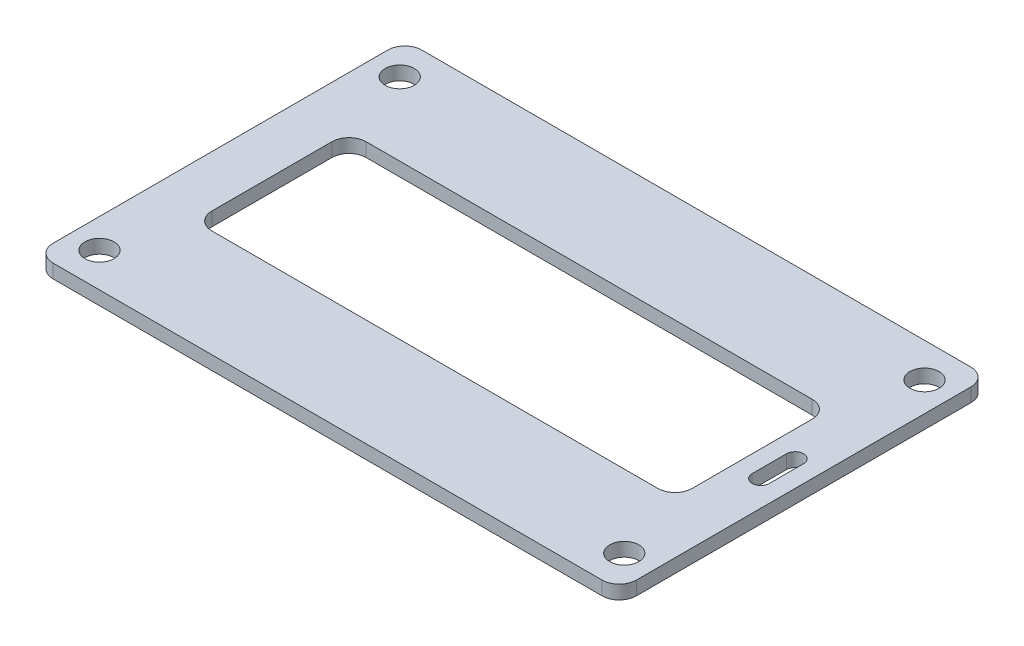
from build123d import *

# Parameters (mm, degrees)
SKETCH1_R           = 1.7
BOSS_EXTRUDE1_DEPTH = 1.6


with BuildPart() as part:
    # Sketch1 → Boss-Extrude1 (new body)
    with BuildSketch(Plane(origin=(0, 0, 0), x_dir=(1, 0, 0), z_dir=(0, 1, 0))):
        with BuildLine():
            Line((-32, -21.5), (32, -21.5))
            ThreePointArc((32, -21.5), (33.414213562, -20.914213562), (34, -19.5))
            Line((34, -19.5), (34, 19.5))
            ThreePointArc((34, 19.5), (33.414213562, 20.914213562), (32, 21.5))
            Line((32, 21.5), (-32, 21.5))
            ThreePointArc((-32, 21.5), (-33.414213562, 20.914213562), (-34, 19.5))
            Line((-34, 19.5), (-34, -19.5))
            ThreePointArc((-34, -19.5), (-33.414213562, -20.914213562), (-32, -21.5))
        make_face()
        with Locations((30.588511348, 17.5)):
            Circle(SKETCH1_R, mode=Mode.SUBTRACT)
        with Locations((-30.588511348, 17.5)):
            Circle(SKETCH1_R, mode=Mode.SUBTRACT)
        with Locations((-30.588511348, -17.5)):
            Circle(SKETCH1_R, mode=Mode.SUBTRACT)
        with Locations((30.588511348, -17.5)):
            Circle(SKETCH1_R, mode=Mode.SUBTRACT)
        with BuildLine():
            Line((28, -7), (28, 7))
            ThreePointArc((28, 7), (27.414213562, 8.414213562), (26, 9))
            Line((26, 9), (-26, 9))
            ThreePointArc((-26, 9), (-27.414213562, 8.414213562), (-28, 7))
            Line((-28, 7), (-28, -7))
            ThreePointArc((-28, -7), (-27.414213562, -8.414213562), (-26, -9))
            Line((-26, -9), (26, -9))
            ThreePointArc((26, -9), (27.414213562, -8.414213562), (28, -7))
        make_face(mode=Mode.SUBTRACT)
        with BuildLine():
            Line((30, 2), (30, -2))
            ThreePointArc((30, -2), (31, -3), (32, -2))
            Line((32, -2), (32, 2))
            ThreePointArc((32, 2), (31, 3), (30, 2))
        make_face(mode=Mode.SUBTRACT)
    extrude(amount=BOSS_EXTRUDE1_DEPTH)


solid = part.part
